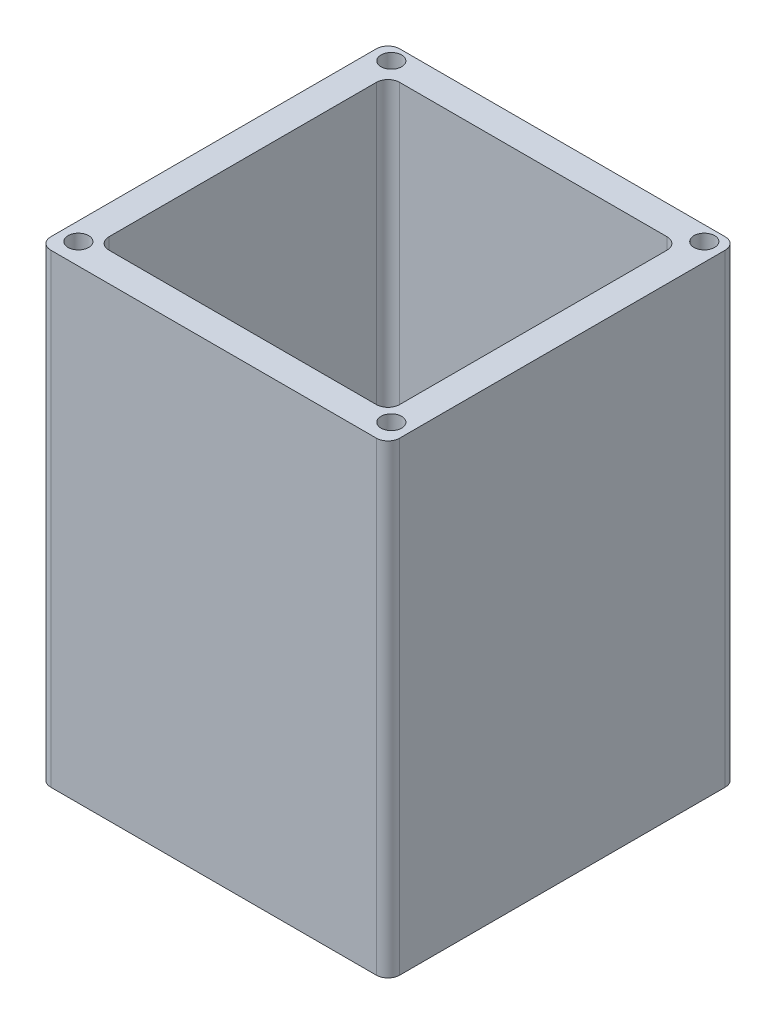
from build123d import *

# Parameters (mm, degrees)
BOSS_EXTRUDE1_DEPTH      = 101.603999992
CUT_EXTRUDE1_DEPTH       = 246.126
SKETCH14_W               = 76.2
SKETCH14_H               = 76.2
SKETCH14_W_2             = 63.5
SKETCH14_H_2             = 63.5
BOSS_EXTRUDE3_DEPTH      = 101.603999992
FILLET1_R                = 2.54
SKETCH16_W               = 40
SKETCH16_H               = 40
CUT_EXTRUDE2_DEPTH       = 2.5
M4_CLEARANCE_HOLE1_D     = 4.5
M4_CLEARANCE_HOLE1_DEPTH = 13.97
M4_CLEARANCE_HOLE1_TIP   = 1.351936393
M4_CLEARANCE_HOLE2_D     = 4.5
M4_CLEARANCE_HOLE2_DEPTH = 13.97
M4_CLEARANCE_HOLE2_TIP   = 1.351936393


with BuildPart() as part:
    # Sketch1 → Boss-Extrude1 (new body)
    with BuildSketch(Plane(origin=(0, 0, 0), x_dir=(1, 0, 0), z_dir=(0, 1, 0))):
        with BuildLine():
            Line((-35.56, -38.1), (35.56, -38.1))
            ThreePointArc((35.56, -38.1), (37.356051224, -37.356051224), (38.1, -35.56))
            Line((38.1, -35.56), (38.1, 35.56))
            ThreePointArc((38.1, 35.56), (37.356051224, 37.356051224), (35.56, 38.1))
            Line((35.56, 38.1), (-35.56, 38.1))
            ThreePointArc((-35.56, 38.1), (-37.356051224, 37.356051224), (-38.1, 35.56))
            Line((-38.1, 35.56), (-38.1, -35.56))
            ThreePointArc((-38.1, -35.56), (-37.356051224, -37.356051224), (-35.56, -38.1))
        make_face()
    extrude(amount=BOSS_EXTRUDE1_DEPTH)

    # Sketch9 → Cut-Extrude1 (cut)
    with BuildSketch(Plane(origin=(0, 101.603999992, 0), x_dir=(1, 0, 0), z_dir=(0, 1, 0))):
        with BuildLine():
            Line((-30.56, -33.1), (30.56, -33.1))
            ThreePointArc((30.56, -33.1), (32.356051224, -32.356051224), (33.1, -30.56))
            Line((33.1, -30.56), (33.1, 30.56))
            ThreePointArc((33.1, 30.56), (32.356051224, 32.356051224), (30.56, 33.1))
            Line((30.56, 33.1), (-30.56, 33.1))
            ThreePointArc((-30.56, 33.1), (-32.356051224, 32.356051224), (-33.1, 30.56))
            Line((-33.1, 30.56), (-33.1, -30.56))
            ThreePointArc((-33.1, -30.56), (-32.356051224, -32.356051224), (-30.56, -33.1))
        make_face()
    extrude(amount=-CUT_EXTRUDE1_DEPTH, mode=Mode.SUBTRACT)

    # Sketch14 → Boss-Extrude3 (add)
    with BuildSketch(Plane(origin=(0, 101.603999992, 0), x_dir=(1, 0, 0), z_dir=(0, 1, 0))):
        Rectangle(SKETCH14_W, SKETCH14_H)
        Rectangle(SKETCH14_W_2, SKETCH14_H_2, mode=Mode.SUBTRACT)
    extrude(amount=-BOSS_EXTRUDE3_DEPTH)

    # Fillet1
    fillet1_edges = [part.edges().sort_by_distance(p)[0] for p in [
        (31.75, 50.801999996, 31.75),
        (-31.75, 50.801999996, 31.75),
        (31.75, 50.801999996, -31.75),
        (-31.75, 50.801999996, -31.75),
        (-38.1, 50.801999996, -38.1),
        (-38.1, 50.801999996, 38.1),
        (38.1, 50.801999996, 38.1),
        (38.1, 50.801999996, -38.1),
    ]]
    fillet(fillet1_edges, radius=FILLET1_R)

    # Sketch16 → Cut-Extrude2 (cut)
    with BuildSketch(Plane(origin=(0, 0, -38.1), x_dir=(-1, 0, 0), z_dir=(0, 0, -1))):
        with Locations((0, 56.007)):
            Rectangle(SKETCH16_W, SKETCH16_H)
    extrude(amount=-CUT_EXTRUDE2_DEPTH, mode=Mode.SUBTRACT)

    # M4 Clearance Hole1
    with Locations(Plane(origin=(0, 101.603999992, 0), x_dir=(1, 0, 0), z_dir=(0, 1, 0))):
        with Locations((-34.181051224, 34.906354293), (34.181051224, 34.906354293), (34.181051224, -33.455748156), (-34.181051224, -33.455748156)):
            Hole(M4_CLEARANCE_HOLE1_D / 2, depth=M4_CLEARANCE_HOLE1_DEPTH)
            with Locations((0, 0, -(M4_CLEARANCE_HOLE1_DEPTH + M4_CLEARANCE_HOLE1_TIP / 2))):  # 118° drill point
                Cone(0, M4_CLEARANCE_HOLE1_D / 2, M4_CLEARANCE_HOLE1_TIP, mode=Mode.SUBTRACT)

    # M4 Clearance Hole2
    with Locations(Plane(origin=(0, 0, 0), x_dir=(-1, 0, 0), z_dir=(0, -1, 0))):
        with Locations((-34.181051224, 34.181051224), (34.181051224, 34.181051224), (34.181051224, -34.181051224), (-34.181051224, -34.181051224)):
            Hole(M4_CLEARANCE_HOLE2_D / 2, depth=M4_CLEARANCE_HOLE2_DEPTH)
            with Locations((0, 0, -(M4_CLEARANCE_HOLE2_DEPTH + M4_CLEARANCE_HOLE2_TIP / 2))):  # 118° drill point
                Cone(0, M4_CLEARANCE_HOLE2_D / 2, M4_CLEARANCE_HOLE2_TIP, mode=Mode.SUBTRACT)


solid = part.part
